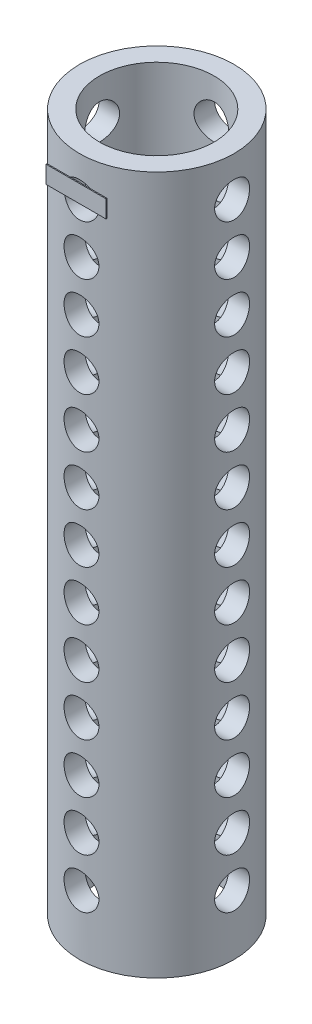
from build123d import *

# Parameters (mm, degrees)
SKETCH1_R           = 7.75
SKETCH1_R_2         = 5.75
BOSS_EXTRUDE1_DEPTH = 70
SKETCH2_R           = 1.75
CUT_EXTRUDE1_DEPTH  = 10
CIRPATTERN1_COUNT   = 4
SKETCH4_W           = 6
SKETCH4_H           = 1.75
BOSS_EXTRUDE2_DEPTH = 0.1


with BuildPart() as part:
    # Sketch1 → Boss-Extrude1 (new body)
    with BuildSketch(Plane(origin=(0, 0, 0), x_dir=(1, 0, 0), z_dir=(0, 1, 0))):
        Circle(SKETCH1_R)
        Circle(SKETCH1_R_2, mode=Mode.SUBTRACT)
    extrude(amount=BOSS_EXTRUDE1_DEPTH)

    # Sketch2 → Cut-Extrude1 (cut, symmetric)
    with BuildSketch(Plane.XY):
        with Locations((0, 66)):
            Circle(SKETCH2_R)
        with Locations((0, 61)):
            Circle(SKETCH2_R)
        with Locations((0, 56)):
            Circle(SKETCH2_R)
        with Locations((0, 51)):
            Circle(SKETCH2_R)
        with Locations((0, 46)):
            Circle(SKETCH2_R)
        with Locations((0, 41)):
            Circle(SKETCH2_R)
        with Locations((0, 36)):
            Circle(SKETCH2_R)
        with Locations((0, 31)):
            Circle(SKETCH2_R)
        with Locations((0, 26)):
            Circle(SKETCH2_R)
        with Locations((0, 21)):
            Circle(SKETCH2_R)
        with Locations((0, 16)):
            Circle(SKETCH2_R)
        with Locations((0, 11)):
            Circle(SKETCH2_R)
        with Locations((0, 6)):
            Circle(SKETCH2_R)
    cut_extrude1 = extrude(amount=CUT_EXTRUDE1_DEPTH, both=True, mode=Mode.SUBTRACT)

    # CirPattern1: Cut-Extrude1 ×4 about axis
    cirpattern1_axis = Axis((0, 70, 0), (0, 1, 0))
    for i in range(1, CIRPATTERN1_COUNT):
        add(cut_extrude1.rotate(cirpattern1_axis, i * 360 / CIRPATTERN1_COUNT), mode=Mode.SUBTRACT)


with BuildPart() as body_2:
    # Sketch4 → Boss-Extrude2 (new body)
    with BuildSketch(Plane.XY.offset(8)):
        with Locations((0, 66.875)):
            Rectangle(SKETCH4_W, SKETCH4_H)
    extrude(amount=BOSS_EXTRUDE2_DEPTH)


solid = Compound([part.part, body_2.part])
